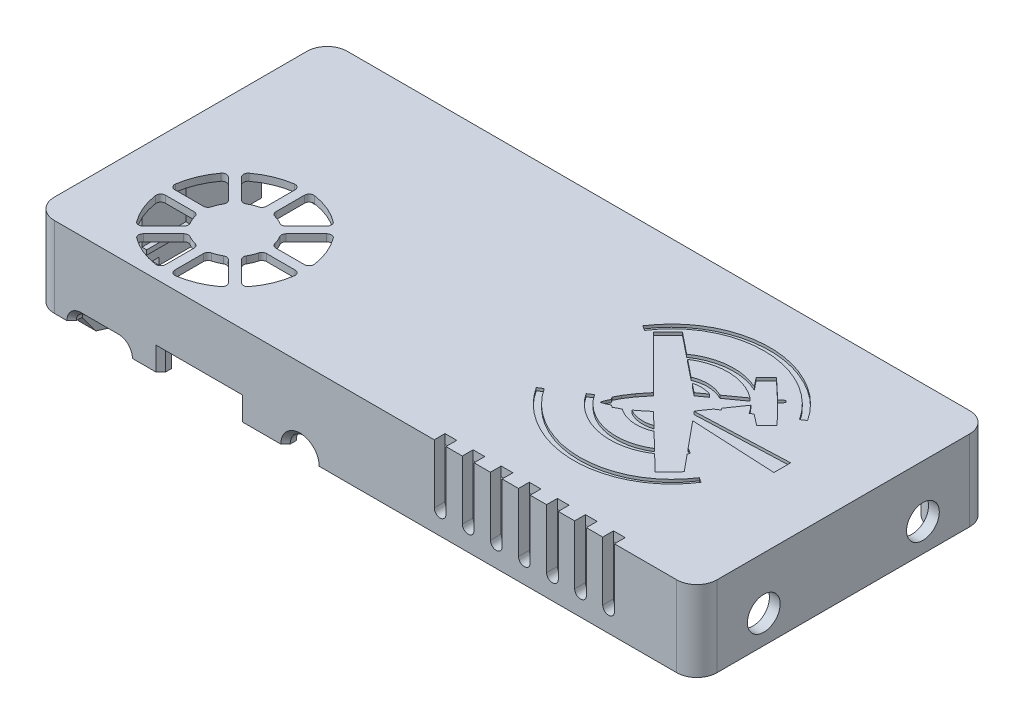
from build123d import *
from OCP.BRepFilletAPI import BRepFilletAPI_MakeChamfer

# Parameters (mm, degrees)
SKETCH3_W                      = 141.6
SKETCH3_H                      = 62.6
SKETCH3_W_2                    = 137
SKETCH3_H_2                    = 58
BOSS_EXTRUDE1_DEPTH            = 17.2
CUT_EXTRUDE1_REACH             = 101.09
SKETCH11_R                     = 3.1
SKETCH11_W                     = 12
SKETCH11_H                     = 2
SKETCH11_W_2                   = 16.5
SKETCH11_H_2                   = 4
SKETCH14_W                     = 2.3
SKETCH14_H                     = 30
BOSS_EXTRUDE6_DEPTH            = 2.8
SKETCH94_W                     = 2.3
SKETCH94_H                     = 13.507377528
BOSS_EXTRUDE11_DEPTH           = 1.5
SKETCH35_W                     = 137
SKETCH35_H                     = 58
BOSS_EXTRUDE7_DEPTH            = 2
CUT_EXTRUDE4_DEPTH             = 0.6
CUT_EXTRUDE5_DEPTH             = 0.6
BOSS_EXTRUDE9_START            = -17.2
SKETCH48_R                     = 4.3
BOSS_EXTRUDE9_DEPTH            = 15.2
BOSS_EXTRUDE10_DEPTH           = 18.3
FILLET15_R                     = 4.3
CUT_EXTRUDE19_REACH            = 148.732
SKETCH68_R                     = 3.5
CUT_EXTRUDE20_DEPTH            = 2.3
FILLET24_R                     = 2
FILLET25_R                     = 2
FILLET26_R                     = 2
CHAMFER1_SIZE                  = 1
FILLET51_R                     = 3
CHAMFER3_SIZE                  = 2
CHAMFER3_SIZE2                 = 2.965121937
F_2_3_2_3_DIAMETER_HOLE2_D     = 2.3
F_2_3_2_3_DIAMETER_HOLE2_DEPTH = 12
F_2_3_2_3_DIAMETER_HOLE1_D     = 2.3
F_2_3_2_3_DIAMETER_HOLE1_DEPTH = 13
CHAMFER4_SIZE                  = 1
CUT_EXTRUDE21_REACH            = 148.732
SKETCH95_W                     = 10
SKETCH95_H                     = 4
FILLET52_R                     = 1
CHAMFER5_SIZE                  = 1
SKETCH96_W                     = 30.5
SKETCH96_H                     = 30.5
CUT_EXTRUDE22_DEPTH            = 0.5
CUT_EXTRUDE23_REACH            = 86.782
SKETCH98_W                     = 2
SKETCH98_H                     = 9.383141043
BOSS_EXTRUDE12_DEPTH           = 7.5
SKETCH100_W                    = 9.383141043
SKETCH100_H                    = 1
BOSS_EXTRUDE13_DEPTH           = 1
SKETCH101_W                    = 9.383141043
SKETCH101_H                    = 1
BOSS_EXTRUDE14_DEPTH           = 1


with BuildPart() as part:
    # Sketch3 → Boss-Extrude1 (new body)
    with BuildSketch(Plane(origin=(0, 0, 0), x_dir=(1, 0, 0), z_dir=(0, 1, 0))):
        with Locations((-4.061766162, 3.105993834)):
            Rectangle(SKETCH3_W, SKETCH3_H)
        with Locations((-4.061766162, 3.105993834)):
            Rectangle(SKETCH3_W_2, SKETCH3_H_2, mode=Mode.SUBTRACT)
    extrude(amount=BOSS_EXTRUDE1_DEPTH)

    # Sketch11 → Cut-Extrude1 (cut, up to next)
    with BuildSketch(Plane.XY.offset(28.194006166), mode=Mode.PRIVATE) as cut_extrude1_sk1:
        with Locations((-18.061766162, 0)):
            Circle(SKETCH11_R)
    cut_extrude1_tool1 = extrude(cut_extrude1_sk1.sketch, amount=-CUT_EXTRUDE1_REACH, mode=Mode.PRIVATE) & part.part
    # Sketch11 → Cut-Extrude1 (cut, up to next)
    with BuildSketch(Plane.XY.offset(28.194006166), mode=Mode.PRIVATE) as cut_extrude1_sk2:
        with Locations((-60.861766162, 1)):
            Rectangle(SKETCH11_W, SKETCH11_H)
    cut_extrude1_tool2 = extrude(cut_extrude1_sk2.sketch, amount=-CUT_EXTRUDE1_REACH, mode=Mode.PRIVATE) & part.part
    # Sketch11 → Cut-Extrude1 (cut, up to next)
    with BuildSketch(Plane.XY.offset(28.194006166), mode=Mode.PRIVATE) as cut_extrude1_sk3:
        with Locations((-39.561766162, 2)):
            Rectangle(SKETCH11_W_2, SKETCH11_H_2)
    cut_extrude1_tool3 = extrude(cut_extrude1_sk3.sketch, amount=-CUT_EXTRUDE1_REACH, mode=Mode.PRIVATE) & part.part
    add(cut_extrude1_tool1.solids().sort_by_distance((-18.061766, 0, 28.194006))[0], mode=Mode.SUBTRACT)
    add(cut_extrude1_tool2.solids().sort_by_distance((-60.861766, 1, 28.194006))[0], mode=Mode.SUBTRACT)
    add(cut_extrude1_tool3.solids().sort_by_distance((-39.561766, 2, 28.194006))[0], mode=Mode.SUBTRACT)

    # Sketch14 → Boss-Extrude6 (add)
    with BuildSketch(Plane.XZ):
        with Locations((-73.711766162, -3.105993834)):
            Rectangle(SKETCH14_W, SKETCH14_H)
    extrude(amount=BOSS_EXTRUDE6_DEPTH)

    # Sketch94 → Boss-Extrude11 (add)
    with BuildSketch(Plane.XZ.offset(2.8)):
        with Locations((-73.711766162, -2.986611136)):
            Rectangle(SKETCH94_W, SKETCH94_H)
    extrude(amount=BOSS_EXTRUDE11_DEPTH)

    # Sketch35 → Boss-Extrude7 (add)
    with BuildSketch(Plane(origin=(0, 17.2, 0), x_dir=(1, 0, 0), z_dir=(0, 1, 0))):
        with Locations((-4.061766162, 3.105993834)):
            Rectangle(SKETCH35_W, SKETCH35_H)
    extrude(amount=-BOSS_EXTRUDE7_DEPTH)

    # Sketch36 → Cut-Extrude4 (cut)
    with BuildSketch(Plane(origin=(0, 17.2, 0), x_dir=(1, 0, 0), z_dir=(0, 1, 0))):
        with BuildLine():
            Line((24.161779637, 0.392233192), (23.011912593, -0.357872059))
            ThreePointArc((23.011912593, -0.357872059), (29.415585328, -3.817531293), (35.804632502, -0.330936576))
            Line((35.804632502, -0.330936576), (34.651616926, 0.414319881))
            ThreePointArc((34.651616926, 0.414319881), (29.412694651, -2.444635175), (24.161779637, 0.392233192))
        make_face()
        with BuildLine():
            Line((24.14743779, 7.203740161), (22.994422214, 7.948996618))
            ThreePointArc((22.994422214, 7.948996618), (29.383469388, 11.435591335), (35.787142123, 7.975932102))
            Line((35.787142123, 7.975932102), (34.63727508, 7.22582685))
            ThreePointArc((34.63727508, 7.22582685), (29.386360065, 10.062695217), (24.14743779, 7.203740161))
        make_face()
        with BuildLine():
            Line((45.948925277, -6.887742795), (46.992328784, -7.562151032))
            ThreePointArc((46.992328784, -7.562151032), (29.443633532, -17.13872583), (11.854766481, -7.636134299))
            Line((11.854766481, -7.636134299), (12.895320773, -6.957338222))
            ThreePointArc((12.895320773, -6.957338222), (29.441017659, -15.896344847), (45.948925277, -6.887742795))
        make_face()
        with BuildLine():
            Line((39.41741464, -2.666073477), (40.524480414, -3.381630087))
            ThreePointArc((40.524480414, -3.381630087), (29.427418261, -9.437456131), (18.30495314, -3.428414016))
            Line((18.30495314, -3.428414016), (19.408995856, -2.708201846))
            ThreePointArc((19.408995856, -2.708201846), (29.424642783, -8.119272462), (39.41741464, -2.666073477))
        make_face()
        with BuildLine():
            Line((12.850129439, 14.505802837), (11.806725932, 15.180211074))
            ThreePointArc((11.806725932, 15.180211074), (29.355421185, 24.756785872), (46.944288235, 15.254194341))
            Line((46.944288235, 15.254194341), (45.903733944, 14.575398264))
            ThreePointArc((45.903733944, 14.575398264), (29.358037058, 23.51440489), (12.850129439, 14.505802837))
        make_face()
        with BuildLine():
            Line((19.381640076, 10.284133519), (18.274574303, 10.999690129))
            ThreePointArc((18.274574303, 10.999690129), (29.371636456, 17.055516173), (40.494101577, 11.046474058))
            Line((40.494101577, 11.046474058), (39.39005886, 10.326261888))
            ThreePointArc((39.39005886, 10.326261888), (29.374411934, 15.737332504), (19.381640076, 10.284133519))
        make_face()
        Polygon((52.970409368, 2.032871576), (31.272458716, 3.1100748), (31.272458716, 4.751527332), (52.970409368, 5.623548989), align=None)
    extrude(amount=-CUT_EXTRUDE4_DEPTH, mode=Mode.SUBTRACT)

    # Sketch37 → Cut-Extrude5 (cut)
    with BuildSketch(Plane(origin=(0, 17.2, 0), x_dir=(1, 0, 0), z_dir=(0, 1, 0))):
        Polygon((28.805009981, 0.4761393), (40.182569063, -10.556645264), (43.238384097, -7.405336011), (33.094377004, 4.899549043), (38.166380551, 12.198472901), (42.417591065, 8.902411722), (44.568940225, 11.120990543), (40.544894779, 15.266245054), (41.344156493, 16.297120883), (41.114611999, 16.475092003), (40.933368387, 16.702061489), (39.914056825, 15.888103135), (35.711539041, 19.852308098), (33.524030257, 17.669374175), (36.880698648, 13.465853336), (29.655237827, 8.289732648), (17.206191432, 18.256292734), (14.099014617, 15.155614134), (25.293775626, 3.93739182), (23.594988453, 1.815468092), (22.403600711, 0.012444552), (21.719985048, -1.305503792), (22.078414673, -1.805843596), (21.679059506, -2.575763756), (21.459015457, -3.268829783), (21.461778406, -3.461536167), (21.654504596, -3.461536167), (22.344344816, -3.231578841), (23.108460643, -2.821227033), (23.613887524, -3.172446882), (24.921900017, -2.470007184), (26.707658365, -1.252893484), align=None)
    extrude(amount=-CUT_EXTRUDE5_DEPTH, mode=Mode.SUBTRACT)

    # Sketch48 → Boss-Extrude9 (add)
    with BuildSketch(Plane(origin=(0, 17.2, 0), x_dir=(1, 0, 0), z_dir=(0, 1, 0)).offset(BOSS_EXTRUDE9_START)):
        with Locations((62.438233838, 30.105993834)):
            Circle(SKETCH48_R)
        with Locations((62.438233838, -23.894006166)):
            Circle(SKETCH48_R)
    extrude(amount=BOSS_EXTRUDE9_DEPTH)

    # Sketch87 → Boss-Extrude10 (add)
    with BuildSketch(Plane.XZ.offset(-15.2)):
        with BuildLine():
            Line((-72.561766162, 25.894006166), (-72.561766162, 18.394006166))
            Line((-72.561766162, 18.394006166), (-68.061766162, 18.394006166))
            ThreePointArc((-68.061766162, 18.394006166), (-65.710015504, 19.531408828), (-65.141523152, 22.08116027))
            Line((-65.141523152, 22.08116027), (-65.614132478, 23.128678858))
            Line((-65.614132478, 23.128678858), (-66.861766162, 25.894006166))
            Line((-66.861766162, 25.894006166), (-72.561766162, 25.894006166))
        make_face()
        with BuildLine():
            Line((-7.061766162, 25.894006166), (-13.061766162, 25.894006166))
            Line((-13.061766162, 25.894006166), (-13.061766162, 21.394006166))
            ThreePointArc((-13.061766162, 21.394006166), (-10.061766162, 18.394006166), (-7.061766162, 21.394006166))
            Line((-7.061766162, 21.394006166), (-7.061766162, 25.894006166))
        make_face()
        with BuildLine():
            Line((-13.061766162, -27.605993834), (-13.061766162, -32.105993834))
            Line((-13.061766162, -32.105993834), (-7.061766162, -32.105993834))
            Line((-7.061766162, -32.105993834), (-7.061766162, -27.605993834))
            ThreePointArc((-7.061766162, -27.605993834), (-10.061766162, -24.605993834), (-13.061766162, -27.605993834))
        make_face()
        with BuildLine():
            Line((-72.561766162, -24.605993834), (-72.561766162, -32.105993834))
            Line((-72.561766162, -32.105993834), (-65.061766162, -32.105993834))
            Line((-65.061766162, -32.105993834), (-65.061766162, -27.605993834))
            ThreePointArc((-65.061766162, -27.605993834), (-65.940445819, -25.484673491), (-68.061766162, -24.605993834))
            Line((-68.061766162, -24.605993834), (-72.561766162, -24.605993834))
        make_face()
    extrude(amount=BOSS_EXTRUDE10_DEPTH)

    # Fillet15
    fillet15_edges = [part.edges().sort_by_distance(p)[0] for p in [
        (-74.861766162, 8.6, -34.405993834),
        (66.738233838, 8.6, -34.405993834),
        (66.738233838, 8.6, 28.194006166),
        (-74.861766162, 8.6, 28.194006166),
    ]]
    fillet(fillet15_edges, radius=FILLET15_R - 0.0001)  # a hair under: the kernel refuses the full size

    # Sketch68 → Cut-Extrude19 (cut, up to next)
    with BuildSketch(Plane(origin=(66.738233838, 0, 0), x_dir=(0, 0, -1), z_dir=(1, 0, 0)), mode=Mode.PRIVATE) as cut_extrude19_sk1:
        with Locations((-13.894006166, 6)):
            Circle(SKETCH68_R)
    cut_extrude19_tool1 = extrude(cut_extrude19_sk1.sketch, amount=-CUT_EXTRUDE19_REACH, mode=Mode.PRIVATE) & part.part
    # Sketch68 → Cut-Extrude19 (cut, up to next)
    with BuildSketch(Plane(origin=(66.738233838, 0, 0), x_dir=(0, 0, -1), z_dir=(1, 0, 0)), mode=Mode.PRIVATE) as cut_extrude19_sk2:
        with Locations((20.105993834, 6)):
            Circle(SKETCH68_R)
    cut_extrude19_tool2 = extrude(cut_extrude19_sk2.sketch, amount=-CUT_EXTRUDE19_REACH, mode=Mode.PRIVATE) & part.part
    add(cut_extrude19_tool1.solids().sort_by_distance((66.738234, 6, 13.894006))[0], mode=Mode.SUBTRACT)
    add(cut_extrude19_tool2.solids().sort_by_distance((66.738234, 6, -20.105994))[0], mode=Mode.SUBTRACT)

    # Sketch81 → Cut-Extrude20 (cut)
    with BuildSketch(Plane.XY.offset(28.194006166)):
        with BuildLine():
            Line((46.626025489, 4.603773013), (46.626025489, 21.603773013))
            ThreePointArc((46.626025489, 21.603773013), (47.876025489, 22.853773013), (49.126025489, 21.603773013))
            Line((49.126025489, 21.603773013), (49.126025489, 4.603773013))
            ThreePointArc((49.126025489, 4.603773013), (47.876025489, 3.353773013), (46.626025489, 4.603773013))
        make_face()
        with BuildLine():
            Line((40.626025489, 4.603773013), (40.626025489, 21.603773013))
            ThreePointArc((40.626025489, 21.603773013), (41.876025489, 22.853773013), (43.126025489, 21.603773013))
            Line((43.126025489, 21.603773013), (43.126025489, 4.603773013))
            ThreePointArc((43.126025489, 4.603773013), (41.876025489, 3.353773013), (40.626025489, 4.603773013))
        make_face()
        with BuildLine():
            Line((34.626025489, 4.603773013), (34.626025489, 21.603773013))
            ThreePointArc((34.626025489, 21.603773013), (35.876025489, 22.853773013), (37.126025489, 21.603773013))
            Line((37.126025489, 21.603773013), (37.126025489, 4.603773013))
            ThreePointArc((37.126025489, 4.603773013), (35.876025489, 3.353773013), (34.626025489, 4.603773013))
        make_face()
        with BuildLine():
            Line((28.626025489, 4.603773013), (28.626025489, 21.603773013))
            ThreePointArc((28.626025489, 21.603773013), (29.876025489, 22.853773013), (31.126025489, 21.603773013))
            Line((31.126025489, 21.603773013), (31.126025489, 4.603773013))
            ThreePointArc((31.126025489, 4.603773013), (29.876025489, 3.353773013), (28.626025489, 4.603773013))
        make_face()
        with BuildLine():
            Line((22.626025489, 4.603773013), (22.626025489, 21.603773013))
            ThreePointArc((22.626025489, 21.603773013), (23.876025489, 22.853773013), (25.126025489, 21.603773013))
            Line((25.126025489, 21.603773013), (25.126025489, 4.603773013))
            ThreePointArc((25.126025489, 4.603773013), (23.876025489, 3.353773013), (22.626025489, 4.603773013))
        make_face()
        with BuildLine():
            Line((16.626025489, 4.603773013), (16.626025489, 21.603773013))
            ThreePointArc((16.626025489, 21.603773013), (17.876025489, 22.853773013), (19.126025489, 21.603773013))
            Line((19.126025489, 21.603773013), (19.126025489, 4.603773013))
            ThreePointArc((19.126025489, 4.603773013), (17.876025489, 3.353773013), (16.626025489, 4.603773013))
        make_face()
        with BuildLine():
            Line((10.626025489, 4.603773013), (10.626025489, 21.603773013))
            ThreePointArc((10.626025489, 21.603773013), (11.876025489, 22.853773013), (13.126025489, 21.603773013))
            Line((13.126025489, 21.603773013), (13.126025489, 4.603773013))
            ThreePointArc((13.126025489, 4.603773013), (11.876025489, 3.353773013), (10.626025489, 4.603773013))
        make_face()
    extrude(amount=-CUT_EXTRUDE20_DEPTH, mode=Mode.SUBTRACT)

    # Fillet24
    fillet24_edges = [part.edges().sort_by_distance(p)[0] for p in [
        (58.631660576, 7.6, -32.105993834),
        (58.631660576, 7.6, 25.894006166),
    ]]
    fillet(fillet24_edges, radius=FILLET24_R)

    # Fillet25
    fillet25_edges = [part.edges().sort_by_distance(p)[0] for p in [
        (-54.861766162, 2, 27.044006166),
    ]]
    fillet(fillet25_edges, radius=FILLET25_R - 0.0001)  # a hair under: the kernel refuses the full size

    # Fillet26
    fillet26_edges = [part.edges().sort_by_distance(p)[0] for p in [
        (-66.861766162, 2, 27.044006166),
    ]]
    fillet(fillet26_edges, radius=FILLET26_R - 0.0001)  # a hair under: the kernel refuses the full size

    # Chamfer1
    chamfer1_edges = [part.edges().sort_by_distance(p)[0] for p in [
        (-47.811766162, 2, 28.194006166),
        (-31.311766162, 2, 28.194006166),
        (-39.561766162, 4, 28.194006166),
        (-18.061766162, 3.1, 28.194006166),
        (-60.861766162, 2, 28.194006166),
        (-55.447523311, 1.414242852, 28.194006166),
        (-66.276009014, 1.414242852, 28.194006166),
    ]]
    chamfer(chamfer1_edges, length=CHAMFER1_SIZE)

    # Fillet51
    fillet51_edges = [part.edges().sort_by_distance(p)[0] for p in [
        (-72.561766162, -1.55, 25.894006166),
        (-72.561766162, -1.55, -32.105993834),
    ]]
    fillet(fillet51_edges, radius=FILLET51_R)

    # Chamfer3: one chamfer whose edges measure the first distance from different faces: ONE call of the kernel's chamfer builder (chamfer() names one face for all edges)
    chamfer3_edges_1 = [part.edges().sort_by_distance(p)[0] for p in [
        (-72.561766162, -3.1, 20.644006166),
        (-68.211766162, -3.1, 25.894006166),
        (-71.683086506, -3.1, 25.015326509),
    ]]
    chamfer3_side_1 = [part.faces().sort_by_distance(p)[0] for p in [
        (-69.044459611, -3.1, 21.965951724),
    ]]
    chamfer3_edges_2 = [part.edges().sort_by_distance(p)[0] for p in [
        (-10.061766162, -3.1, 25.894006166),
    ]]
    chamfer3_side_2 = [part.faces().sort_by_distance(p)[0] for p in [
        (-10.061766162, -3.1, 22.433212392),
    ]]
    chamfer3_edges_3 = [part.edges().sort_by_distance(p)[0] for p in [
        (-10.061766162, -3.1, -32.105993834),
    ]]
    chamfer3_side_3 = [part.faces().sort_by_distance(p)[0] for p in [
        (-10.061766162, -3.1, -28.64520006),
    ]]
    chamfer3_edges_4 = [part.edges().sort_by_distance(p)[0] for p in [
        (-67.311766162, -3.1, -32.105993834),
        (-72.561766162, -3.1, -26.855993834),
        (-71.683086506, -3.1, -31.227314178),
    ]]
    chamfer3_side_4 = [part.faces().sort_by_distance(p)[0] for p in [
        (-68.811766162, -3.1, -28.355993834),
    ]]
    chamfer3 = BRepFilletAPI_MakeChamfer(part.part.solid().wrapped)
    for e in chamfer3_edges_1:
        chamfer3.Add(CHAMFER3_SIZE, CHAMFER3_SIZE2, e.wrapped, chamfer3_side_1[0].wrapped)  # the first distance lies on this face
    for e in chamfer3_edges_2:
        chamfer3.Add(CHAMFER3_SIZE, CHAMFER3_SIZE2, e.wrapped, chamfer3_side_2[0].wrapped)  # the first distance lies on this face
    for e in chamfer3_edges_3:
        chamfer3.Add(CHAMFER3_SIZE, CHAMFER3_SIZE2, e.wrapped, chamfer3_side_3[0].wrapped)  # the first distance lies on this face
    for e in chamfer3_edges_4:
        chamfer3.Add(CHAMFER3_SIZE, CHAMFER3_SIZE2, e.wrapped, chamfer3_side_4[0].wrapped)  # the first distance lies on this face
    add(Compound.cast(chamfer3.Shape()), mode=Mode.REPLACE)

    # Ø2.3 (2.3) Diameter Hole2
    with Locations(Plane(origin=(0, 0, 0), x_dir=(-1, 0, 0), z_dir=(0, -1, 0))):
        with Locations((-62.438233838, -23.894006166), (-62.438233838, 30.105993834)):
            Hole(F_2_3_2_3_DIAMETER_HOLE2_D / 2, depth=F_2_3_2_3_DIAMETER_HOLE2_DEPTH)

    # Ø2.3 (2.3) Diameter Hole1
    with Locations(Plane(origin=(0, -3.1, 0), x_dir=(-1, 0, 0), z_dir=(0, -1, 0))):
        with Locations((68.061766162, -21.394006166), (68.061766162, 27.605993834), (10.061766162, 27.605993834), (10.061766162, -21.394006166)):
            Hole(F_2_3_2_3_DIAMETER_HOLE1_D / 2, depth=F_2_3_2_3_DIAMETER_HOLE1_DEPTH)

    # Chamfer4
    chamfer4_edges = [part.edges().sort_by_distance(p)[0] for p in [
        (-74.861766162, -4.3, -2.986611136),
    ]]
    chamfer(chamfer4_edges, length=CHAMFER4_SIZE)

    # Sketch95 → Cut-Extrude21 (cut, up to next)
    with BuildSketch(Plane.ZY.offset(74.861766162), mode=Mode.PRIVATE) as cut_extrude21_sk1:
        with Locations((-18.605993834, 11.2)):
            Rectangle(SKETCH95_W, SKETCH95_H)
    cut_extrude21_tool1 = extrude(cut_extrude21_sk1.sketch, amount=-CUT_EXTRUDE21_REACH, mode=Mode.PRIVATE) & part.part
    add(cut_extrude21_tool1.solids().sort_by_distance((-74.861766, 11.2, -18.605994))[0], mode=Mode.SUBTRACT)

    # Fillet52
    fillet52_edges = [part.edges().sort_by_distance(p)[0] for p in [
        (-73.711766162, 13.2, -13.605993834),
        (-73.711766162, 9.2, -13.605993834),
        (-73.711766162, 9.2, -23.605993834),
        (-73.711766162, 13.2, -23.605993834),
    ]]
    fillet(fillet52_edges, radius=FILLET52_R)

    # Chamfer5
    chamfer5_edges = [part.edges().sort_by_distance(p)[0] for p in [
        (-74.861766162, 9.2, -18.605993834),
        (-74.861766162, 11.2, -23.605993834),
        (-74.861766162, 11.2, -13.605993834),
        (-74.861766162, 13.2, -18.605993834),
        (-74.861766162, 9.492893219, -23.313100616),
        (-74.861766162, 9.492893219, -13.898887053),
        (-74.861766162, 12.907106781, -13.898887053),
        (-74.861766162, 12.907106781, -23.313100616),
    ]]
    chamfer(chamfer5_edges, length=CHAMFER5_SIZE)

    # Sketch96 → Cut-Extrude22 (cut)
    with BuildSketch(Plane.XZ.offset(-15.2)):
        with Locations((-49.504925423, 10.644006166)):
            Rectangle(SKETCH96_W, SKETCH96_H)
    extrude(amount=-CUT_EXTRUDE22_DEPTH, mode=Mode.SUBTRACT)

    # Sketch97 → Cut-Extrude23 (cut, up to next)
    with BuildSketch(Plane.XZ.offset(-15.7), mode=Mode.PRIVATE) as cut_extrude23_sk1:
        with BuildLine():
            Line((-48.504925423, 18.389972858), (-48.504925423, 24.500412626))
            ThreePointArc((-48.504925423, 24.500412626), (-48.159579094, 25.256341572), (-47.36206828, 25.490155945))
            ThreePointArc((-47.36206828, 25.490155945), (-43.764673938, 24.502199153), (-40.522341057, 22.657048166))
            ThreePointArc((-40.522341057, 22.657048166), (-40.123747481, 21.927791133), (-40.414073233, 21.149071918))
            Line((-40.414073233, 21.149071918), (-44.734806629, 16.828338522))
            ThreePointArc((-44.734806629, 16.828338522), (-45.315909118, 16.543415607), (-45.949789912, 16.674015411))
            ThreePointArc((-45.949789912, 16.674015411), (-46.826141397, 17.111162893), (-47.754925423, 17.421727022))
            ThreePointArc((-47.754925423, 17.421727022), (-48.295494838, 17.777600422), (-48.504925423, 18.389972858))
        make_face()
    cut_extrude23_tool1 = extrude(cut_extrude23_sk1.sketch, amount=-CUT_EXTRUDE23_REACH, mode=Mode.PRIVATE) & part.part
    # Sketch97 → Cut-Extrude23 (cut, up to next)
    with BuildSketch(Plane.XZ.offset(-15.7), mode=Mode.PRIVATE) as cut_extrude23_sk2:
        with BuildLine():
            Line((-50.504925423, 18.389972858), (-50.504925423, 24.500412626))
            ThreePointArc((-50.504925423, 24.500412626), (-50.850271752, 25.256341572), (-51.647782566, 25.490155945))
            ThreePointArc((-51.647782566, 25.490155945), (-55.245176909, 24.502199153), (-58.48750979, 22.657048166))
            ThreePointArc((-58.48750979, 22.657048166), (-58.886103366, 21.927791133), (-58.595777613, 21.149071918))
            Line((-58.595777613, 21.149071918), (-54.275044217, 16.828338522))
            ThreePointArc((-54.275044217, 16.828338522), (-53.693941728, 16.543415607), (-53.060060934, 16.674015411))
            ThreePointArc((-53.060060934, 16.674015411), (-52.18370945, 17.111162893), (-51.254925423, 17.421727022))
            ThreePointArc((-51.254925423, 17.421727022), (-50.714356008, 17.777600422), (-50.504925423, 18.389972858))
        make_face()
    cut_extrude23_tool2 = extrude(cut_extrude23_sk2.sketch, amount=-CUT_EXTRUDE23_REACH, mode=Mode.PRIVATE) & part.part
    # Sketch97 → Cut-Extrude23 (cut, up to next)
    with BuildSketch(Plane.XZ.offset(-15.7), mode=Mode.PRIVATE) as cut_extrude23_sk3:
        with BuildLine():
            Line((-43.320593067, 15.41412496), (-38.999859671, 19.734858356))
            ThreePointArc((-38.999859671, 19.734858356), (-38.221140456, 20.025184108), (-37.491883423, 19.626590532))
            ThreePointArc((-37.491883423, 19.626590532), (-35.646732435, 16.384257651), (-34.658775644, 12.786863309))
            ThreePointArc((-34.658775644, 12.786863309), (-34.892590017, 11.989352495), (-35.648518963, 11.644006166))
            Line((-35.648518963, 11.644006166), (-41.758958731, 11.644006166))
            ThreePointArc((-41.758958731, 11.644006166), (-42.371331166, 11.853436751), (-42.727204567, 12.394006166))
            ThreePointArc((-42.727204567, 12.394006166), (-43.037768696, 13.322790192), (-43.474916178, 14.199141677))
            ThreePointArc((-43.474916178, 14.199141677), (-43.605515982, 14.833022471), (-43.320593067, 15.41412496))
        make_face()
    cut_extrude23_tool3 = extrude(cut_extrude23_sk3.sketch, amount=-CUT_EXTRUDE23_REACH, mode=Mode.PRIVATE) & part.part
    # Sketch97 → Cut-Extrude23 (cut, up to next)
    with BuildSketch(Plane.XZ.offset(-15.7), mode=Mode.PRIVATE) as cut_extrude23_sk4:
        with BuildLine():
            Line((-41.758958731, 9.644006166), (-35.648518963, 9.644006166))
            ThreePointArc((-35.648518963, 9.644006166), (-34.892590017, 9.298659836), (-34.658775644, 8.501149023))
            ThreePointArc((-34.658775644, 8.501149023), (-35.646732435, 4.90375468), (-37.491883423, 1.661421799))
            ThreePointArc((-37.491883423, 1.661421799), (-38.221140456, 1.262828223), (-38.999859671, 1.553153976))
            Line((-38.999859671, 1.553153976), (-43.320593067, 5.873887372))
            ThreePointArc((-43.320593067, 5.873887372), (-43.605515982, 6.454989861), (-43.474916178, 7.088870655))
            ThreePointArc((-43.474916178, 7.088870655), (-43.037768696, 7.965222139), (-42.727204567, 8.894006166))
            ThreePointArc((-42.727204567, 8.894006166), (-42.371331166, 9.434575581), (-41.758958731, 9.644006166))
        make_face()
    cut_extrude23_tool4 = extrude(cut_extrude23_sk4.sketch, amount=-CUT_EXTRUDE23_REACH, mode=Mode.PRIVATE) & part.part
    # Sketch97 → Cut-Extrude23 (cut, up to next)
    with BuildSketch(Plane.XZ.offset(-15.7), mode=Mode.PRIVATE) as cut_extrude23_sk5:
        with BuildLine():
            Line((-44.734806629, 4.459673809), (-40.414073233, 0.138940413))
            ThreePointArc((-40.414073233, 0.138940413), (-40.123747481, -0.639778802), (-40.522341057, -1.369035835))
            ThreePointArc((-40.522341057, -1.369035835), (-43.764673938, -3.214186822), (-47.36206828, -4.202143613))
            ThreePointArc((-47.36206828, -4.202143613), (-48.159579094, -3.968329241), (-48.504925423, -3.212400295))
            Line((-48.504925423, -3.212400295), (-48.504925423, 2.898039473))
            ThreePointArc((-48.504925423, 2.898039473), (-48.295494838, 3.510411909), (-47.754925423, 3.86628531))
            ThreePointArc((-47.754925423, 3.86628531), (-46.826141397, 4.176849438), (-45.949789912, 4.61399692))
            ThreePointArc((-45.949789912, 4.61399692), (-45.315909118, 4.744596725), (-44.734806629, 4.459673809))
        make_face()
    cut_extrude23_tool5 = extrude(cut_extrude23_sk5.sketch, amount=-CUT_EXTRUDE23_REACH, mode=Mode.PRIVATE) & part.part
    # Sketch97 → Cut-Extrude23 (cut, up to next)
    with BuildSketch(Plane.XZ.offset(-15.7), mode=Mode.PRIVATE) as cut_extrude23_sk6:
        with BuildLine():
            Line((-50.504925423, 2.898039473), (-50.504925423, -3.212400295))
            ThreePointArc((-50.504925423, -3.212400295), (-50.850271752, -3.968329241), (-51.647782566, -4.202143613))
            ThreePointArc((-51.647782566, -4.202143613), (-55.245176909, -3.214186822), (-58.48750979, -1.369035835))
            ThreePointArc((-58.48750979, -1.369035835), (-58.886103366, -0.639778802), (-58.595777613, 0.138940413))
            Line((-58.595777613, 0.138940413), (-54.275044217, 4.459673809))
            ThreePointArc((-54.275044217, 4.459673809), (-53.693941728, 4.744596725), (-53.060060934, 4.61399692))
            ThreePointArc((-53.060060934, 4.61399692), (-52.18370945, 4.176849438), (-51.254925423, 3.86628531))
            ThreePointArc((-51.254925423, 3.86628531), (-50.714356008, 3.510411909), (-50.504925423, 2.898039473))
        make_face()
    cut_extrude23_tool6 = extrude(cut_extrude23_sk6.sketch, amount=-CUT_EXTRUDE23_REACH, mode=Mode.PRIVATE) & part.part
    # Sketch97 → Cut-Extrude23 (cut, up to next)
    with BuildSketch(Plane.XZ.offset(-15.7), mode=Mode.PRIVATE) as cut_extrude23_sk7:
        with BuildLine():
            Line((-55.689257779, 5.873887372), (-60.009991175, 1.553153976))
            ThreePointArc((-60.009991175, 1.553153976), (-60.788710391, 1.262828223), (-61.517967423, 1.661421799))
            ThreePointArc((-61.517967423, 1.661421799), (-63.363118411, 4.90375468), (-64.351075202, 8.501149023))
            ThreePointArc((-64.351075202, 8.501149023), (-64.11726083, 9.298659836), (-63.361331884, 9.644006166))
            Line((-63.361331884, 9.644006166), (-57.250892116, 9.644006166))
            ThreePointArc((-57.250892116, 9.644006166), (-56.63851968, 9.434575581), (-56.282646279, 8.894006166))
            ThreePointArc((-56.282646279, 8.894006166), (-55.972082151, 7.965222139), (-55.534934668, 7.088870655))
            ThreePointArc((-55.534934668, 7.088870655), (-55.404334864, 6.454989861), (-55.689257779, 5.873887372))
        make_face()
    cut_extrude23_tool7 = extrude(cut_extrude23_sk7.sketch, amount=-CUT_EXTRUDE23_REACH, mode=Mode.PRIVATE) & part.part
    # Sketch97 → Cut-Extrude23 (cut, up to next)
    with BuildSketch(Plane.XZ.offset(-15.7), mode=Mode.PRIVATE) as cut_extrude23_sk8:
        with BuildLine():
            Line((-57.250892116, 11.644006166), (-63.361331884, 11.644006166))
            ThreePointArc((-63.361331884, 11.644006166), (-64.11726083, 11.989352495), (-64.351075202, 12.786863309))
            ThreePointArc((-64.351075202, 12.786863309), (-63.363118411, 16.384257651), (-61.517967423, 19.626590532))
            ThreePointArc((-61.517967423, 19.626590532), (-60.788710391, 20.025184108), (-60.009991175, 19.734858356))
            Line((-60.009991175, 19.734858356), (-55.689257779, 15.41412496))
            ThreePointArc((-55.689257779, 15.41412496), (-55.404334864, 14.833022471), (-55.534934668, 14.199141677))
            ThreePointArc((-55.534934668, 14.199141677), (-55.972082151, 13.322790192), (-56.282646279, 12.394006166))
            ThreePointArc((-56.282646279, 12.394006166), (-56.63851968, 11.853436751), (-57.250892116, 11.644006166))
        make_face()
    cut_extrude23_tool8 = extrude(cut_extrude23_sk8.sketch, amount=-CUT_EXTRUDE23_REACH, mode=Mode.PRIVATE) & part.part
    add(cut_extrude23_tool1.solids().sort_by_distance((-45.125774, 15.7, 21.216213))[0], mode=Mode.SUBTRACT)
    add(cut_extrude23_tool2.solids().sort_by_distance((-53.884077, 15.7, 21.216213))[0], mode=Mode.SUBTRACT)
    add(cut_extrude23_tool3.solids().sort_by_distance((-38.932718, 15.7, 15.023158))[0], mode=Mode.SUBTRACT)
    add(cut_extrude23_tool4.solids().sort_by_distance((-38.932718, 15.7, 6.264855))[0], mode=Mode.SUBTRACT)
    add(cut_extrude23_tool5.solids().sort_by_distance((-45.125774, 15.7, 0.071799))[0], mode=Mode.SUBTRACT)
    add(cut_extrude23_tool6.solids().sort_by_distance((-53.884077, 15.7, 0.071799))[0], mode=Mode.SUBTRACT)
    add(cut_extrude23_tool7.solids().sort_by_distance((-60.077133, 15.7, 6.264855))[0], mode=Mode.SUBTRACT)
    add(cut_extrude23_tool8.solids().sort_by_distance((-60.077133, 15.7, 15.023158))[0], mode=Mode.SUBTRACT)

    # Sketch98 → Boss-Extrude12 (add)
    with BuildSketch(Plane.XZ.offset(-15.2)):
        with Locations((-65.754925423, 10.573768169)):
            Rectangle(SKETCH98_W, SKETCH98_H)
        with Locations((-33.254925423, 10.644006166)):
            Rectangle(SKETCH98_W, SKETCH98_H)
    extrude(amount=BOSS_EXTRUDE12_DEPTH)

    # Sketch100 → Boss-Extrude13 (add)
    with BuildSketch(Plane(origin=(-64.754925423, 0, 0), x_dir=(0, 0, -1), z_dir=(1, 0, 0))):
        with Locations((-10.573768169, 8.2)):
            Rectangle(SKETCH100_W, SKETCH100_H)
    extrude(amount=BOSS_EXTRUDE13_DEPTH)

    # Sketch101 → Boss-Extrude14 (add)
    with BuildSketch(Plane.ZY.offset(34.254925423)):
        with Locations((10.644006166, 8.2)):
            Rectangle(SKETCH101_W, SKETCH101_H)
    extrude(amount=BOSS_EXTRUDE14_DEPTH)


solid = part.part
